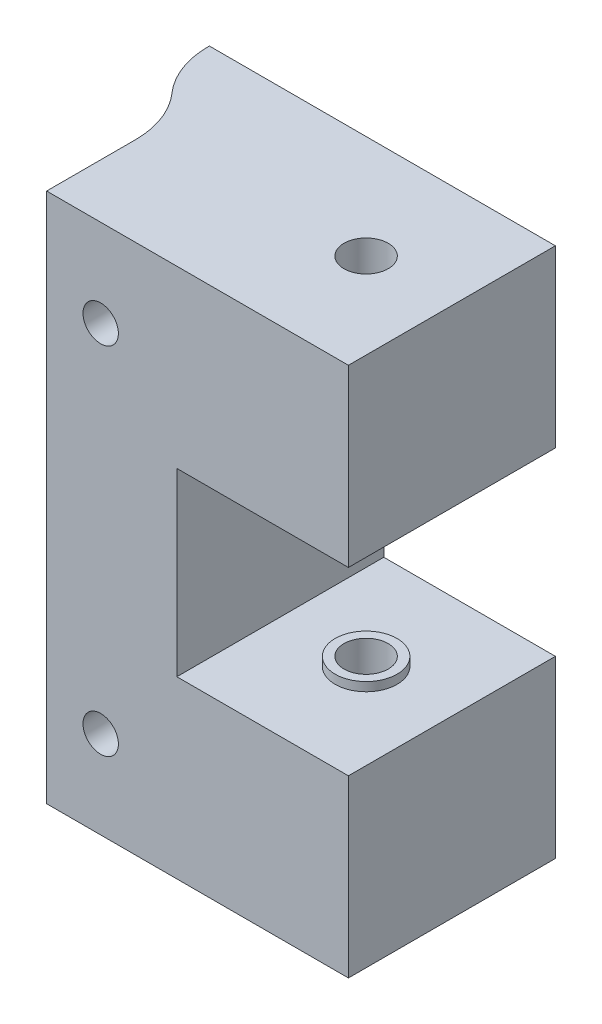
from build123d import *

# Parameters (mm, degrees)
MAINBLOCK_R                     = 2
MAINBLOCKBOSS_EXTRUDE1_DEPTH    = 23.4
TOPHOLECUT_SKETCH2_R            = 2.5
TOPHOLECUT_EXTRUDE1_DEPTH       = 45
TOPSPACERSKETCH4_R              = 3.5
TOPSPACERSKETCH4_R_2            = 2.5
TOPSPACERBOSS_EXTRUDE2_DEPTH    = 1
LOWERSPACERBOSS_EXTRUDE3_START  = 1
LOWERSPACERSKETCH5_R            = 3.5
LOWERSPACERSKETCH5_R_2          = 2.5
LOWERSPACERBOSS_EXTRUDE3_DEPTH  = 1
MOUNTHOLEBORECUT_EXTRUDE1_DEPTH = 2
PUSHPINHOLESKETCH1_R            = 1
PUSHPINHOLECUT_EXTRUDE1_DEPTH   = 76.354665582
SCREWCOLLISIONSKETCH1_W         = 18.72
SCREWCOLLISIONSKETCH1_H         = 60
CUT_EXTRUDE1_DEPTH              = 5
FILLET1_R                       = 10
FILLET2_R                       = 10
MIDRAILINSETSKETCH1_W           = 3.18
MIDRAILINSETSKETCH1_H           = 40.4
MIDRAILINSETCUT_EXTRUDE2_DEPTH  = 76.354665582


with BuildPart() as part:
    # MainBlock → MainBlockBoss-Extrude1 (new body)
    with BuildSketch(Plane.XY):
        Polygon((0, 0), (39.125, 0), (39.125, 19.8), (19.725, 19.8), (19.725, 40.2), (39.125, 40.2), (39.125, 60), (0, 60), align=None)
        with Locations((11.1125, 50.1)):
            Circle(MAINBLOCK_R, mode=Mode.SUBTRACT)
        with Locations((11.1125, 9.9)):
            Circle(MAINBLOCK_R, mode=Mode.SUBTRACT)
    extrude(amount=MAINBLOCKBOSS_EXTRUDE1_DEPTH)

    # TopHoleCut-Sketch2 → TopHoleCut-Extrude1 (cut)
    with BuildSketch(Plane(origin=(0, 60, 0), x_dir=(1, 0, 0), z_dir=(0, 1, 0))):
        with Locations(Location((29.425, -11.7, 0), (0, 0, 270))):
            Circle(TOPHOLECUT_SKETCH2_R)
    extrude(amount=-TOPHOLECUT_EXTRUDE1_DEPTH, mode=Mode.SUBTRACT)

    # TopSpacerSketch4 → TopSpacerBoss-Extrude2 (add)
    with BuildSketch(Plane.XZ.offset(-40.2)):
        with Locations(Location((29.425, 11.7, 0), (0, 0, 90))):
            Circle(TOPSPACERSKETCH4_R)
        with Locations(Location((29.425, 11.7, 0), (0, 0, 90))):
            Circle(TOPSPACERSKETCH4_R_2, mode=Mode.SUBTRACT)
    extrude(amount=TOPSPACERBOSS_EXTRUDE2_DEPTH)

    # LowerSpacerSketch5 → LowerSpacerBoss-Extrude3 (add)
    with BuildSketch(Plane(origin=(0, 19.8, 0), x_dir=(1, 0, 0), z_dir=(0, 1, 0)).offset(LOWERSPACERBOSS_EXTRUDE3_START)):
        with Locations(Location((29.425, -11.7, 0), (0, 0, 270))):
            Circle(LOWERSPACERSKETCH5_R)
        with Locations(Location((29.425, -11.7, 0), (0, 0, 270))):
            Circle(LOWERSPACERSKETCH5_R_2, mode=Mode.SUBTRACT)
    extrude(amount=-LOWERSPACERBOSS_EXTRUDE3_DEPTH)

    # MountHoleBoreSketch1 → MountHoleBoreCut-Extrude1 (cut)
    with BuildSketch(Plane(origin=(0, 0, 0), x_dir=(-1, 0, 0), z_dir=(0, 0, -1))):
        Polygon((-7.2375, 50.1), (-9.175, 53.45584844), (-13.05, 53.45584844), (-14.9875, 50.1), (-13.05, 46.74415156), (-9.175, 46.74415156), align=None)
        Polygon((-7.2375, 9.9), (-9.175, 13.25584844), (-13.05, 13.25584844), (-14.9875, 9.9), (-13.05, 6.54415156), (-9.175, 6.54415156), align=None)
    extrude(amount=-MOUNTHOLEBORECUT_EXTRUDE1_DEPTH, mode=Mode.SUBTRACT)

    # PushPinHoleSketch1 → PushPinHoleCut-Extrude1 (cut, through all)
    with BuildSketch(Plane.XZ):
        with Locations(Location((29.425, 11.7, 0), (0, 0, 270))):
            Circle(PUSHPINHOLESKETCH1_R)
    extrude(amount=-PUSHPINHOLECUT_EXTRUDE1_DEPTH, mode=Mode.SUBTRACT)

    # ScrewCollisionSketch1 → Cut-Extrude1 (cut)
    with BuildSketch(Plane.ZY):
        with Locations((14.04, 30)):
            Rectangle(SCREWCOLLISIONSKETCH1_W, SCREWCOLLISIONSKETCH1_H)
    extrude(amount=-CUT_EXTRUDE1_DEPTH, mode=Mode.SUBTRACT)

    # Fillet1
    # the kernel refuses this fillet: 10 mm, written as the material it adds along each edge
    with BuildSketch(Plane(origin=(5, 60, 4.68), x_dir=(0, 0, 1), z_dir=(0, -1, 0))) as fillet1_piece_1:
        with BuildLine():
            CenterArc((8.660254038, 10), FILLET1_R, 210, 60)
            Line((0, 5), (-0.173205081, 4.9))
            ThreePointArc((-0.173205081, 4.9), (-0.2, 2.5), (-0.2, 0))
            Line((-0.2, 0), (0, -0.2))
            Line((0, -0.2), (8.660254038, -0.2))
            Line((8.660254038, -0.2), (8.660254038, 0))
        make_face()
    extrude(amount=60)

    # Fillet2
    fillet2_edges = [part.edges().sort_by_distance(p)[0] for p in [
        (0, 30, 4.68),
    ]]
    fillet(fillet2_edges, radius=FILLET2_R)

    # MidRailInsetSketch1 → MidRailInsetCut-Extrude2 (cut, through all)
    with BuildSketch(Plane(origin=(0, 0, 0), x_dir=(-1, 0, 0), z_dir=(0, 0, -1))):
        with Locations((-1.59, 20.2)):
            Rectangle(MIDRAILINSETSKETCH1_W, MIDRAILINSETSKETCH1_H)
    extrude(amount=-MIDRAILINSETCUT_EXTRUDE2_DEPTH, mode=Mode.SUBTRACT)


solid = part.part
